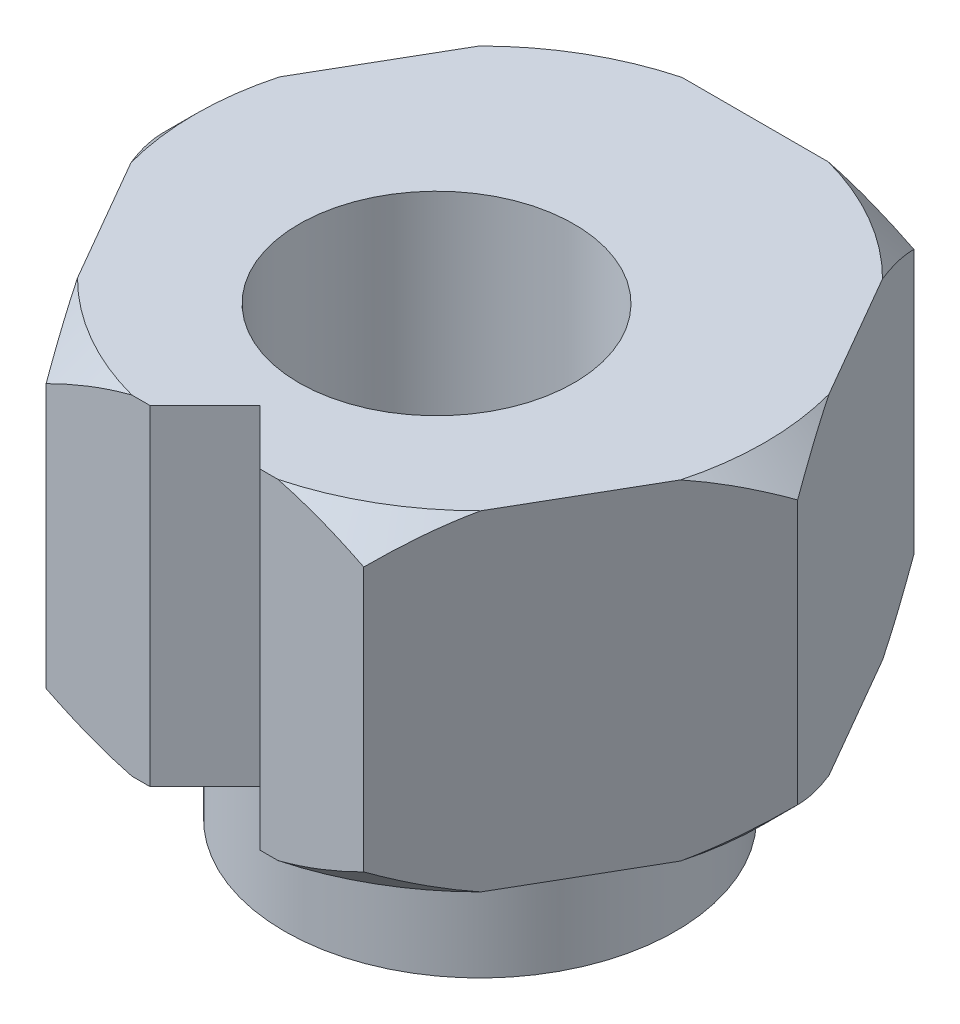
from build123d import *

# Parameters (mm, degrees)
BOSS_EXTRUDE1_DEPTH = 6
SKETCH3_R           = 3.555
BOSS_EXTRUDE3_DEPTH = 2.5
SKETCH4_R           = 2.5
CUT_EXTRUDE1_DEPTH  = 12.427306478
CUT_EXTRUDE2_DEPTH  = 10.712534856


with BuildPart() as part:
    # Sketch1 → Boss-Extrude1 (new body)
    with BuildSketch(Plane(origin=(0, 0, 0), x_dir=(1, 0, 0), z_dir=(0, 1, 0))):
        Polygon((5.773502692, 0), (2.886751346, 5), (-2.886751346, 5), (-5.773502692, 0), (-2.886751346, -5), (2.886751346, -5), align=None)
    extrude(amount=BOSS_EXTRUDE1_DEPTH)

    # Sketch3 → Boss-Extrude3 (add)
    with BuildSketch(Plane.XZ):
        Circle(SKETCH3_R)
    extrude(amount=BOSS_EXTRUDE3_DEPTH)

    # Sketch4 → Cut-Extrude1 (cut, through all)
    with BuildSketch(Plane(origin=(0, 6, 0), x_dir=(1, 0, 0), z_dir=(0, 1, 0))):
        with Locations((0, -0.79)):
            Circle(SKETCH4_R)
    extrude(amount=-CUT_EXTRUDE1_DEPTH, mode=Mode.SUBTRACT)

    # Sketch5 → Cut-Extrude2 (cut, through all)
    with BuildSketch(Plane(origin=(0, 0, 0), x_dir=(-1, 0, 0), z_dir=(0, -1, 0))):
        Polygon((-1, -5), (1, -5), (0, -4), align=None)
    extrude(amount=-CUT_EXTRUDE2_DEPTH, mode=Mode.SUBTRACT)

    # Sketch6 → Cut-Revolve1 (revolve, cut)
    with BuildSketch(Plane.XY):
        Polygon((5.173502692, 6), (5.773502692, 6), (5.773502692, 5.4), align=None)
        Polygon((5.773502692, 0.6), (5.173502692, 0), (5.773502692, 0), align=None)
    revolve(axis=Axis((0, 0, 0), (0, 1, 0)), mode=Mode.SUBTRACT)


solid = part.part
